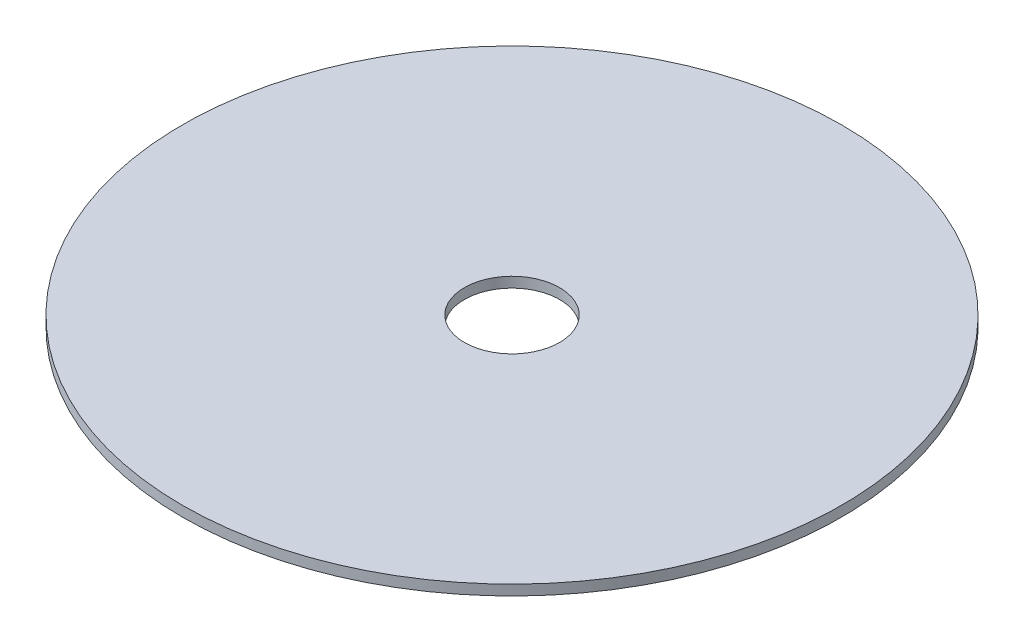
from build123d import *

# Parameters (mm, degrees)
SKETCH1_R          = 50.8
SKETCH1_R_2        = 7.332348419
BASE_FLANGE1_DEPTH = 1.5875


# Sheet-metal steps are written as plain solids
with BuildPart() as part:
    # Sketch1 → Base-Flange1 (new body)
    with BuildSketch(Plane(origin=(0, 0, 0), x_dir=(1, 0, 0), z_dir=(0, 1, 0))):
        with Locations(Location((0, 0, 0), (0, 0, 270))):
            Circle(SKETCH1_R)
        with Locations(Location((0, 0, 0), (0, 0, 270))):
            Circle(SKETCH1_R_2, mode=Mode.SUBTRACT)
    extrude(amount=-BASE_FLANGE1_DEPTH)


solid = part.part
